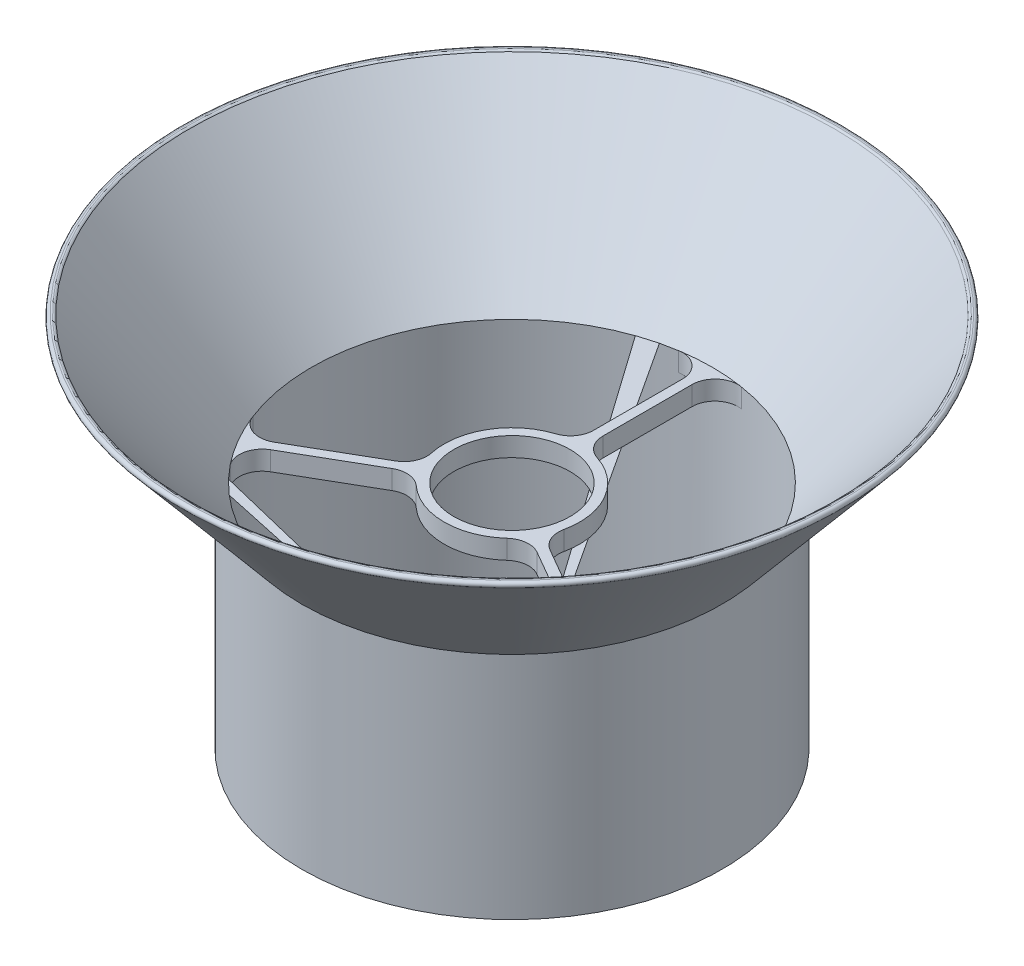
from build123d import *

# Parameters (mm, degrees)
SKETCH1_R           = 69.723
SKETCH1_R_2         = 66.548
BOSS_EXTRUDE1_DEPTH = 76.2
SKETCH2_R           = 22.479
SKETCH2_R_2         = 19.304
BOSS_EXTRUDE2_DEPTH = 6.35
BOSS_EXTRUDE3_START = -6.35
BOSS_EXTRUDE3_DEPTH = 6.35
CIRPATTERN1_COUNT   = 3
FILLET4_R           = 7.62
FILLET6_R           = 1.016


with BuildPart() as part:
    # Sketch1 → Boss-Extrude1 (new body)
    with BuildSketch(Plane(origin=(0, 0, 0), x_dir=(1, 0, 0), z_dir=(0, 1, 0))):
        with Locations(Location((0, 0, 0), (0, 0, 90))):
            Circle(SKETCH1_R)
        with Locations(Location((0, 0, 0), (0, 0, 90))):
            Circle(SKETCH1_R_2, mode=Mode.SUBTRACT)
    extrude(amount=BOSS_EXTRUDE1_DEPTH)



with BuildPart() as body_2:
    # Sketch2 → Boss-Extrude2 (new body)
    with BuildSketch(Plane(origin=(0, 76.2, 0), x_dir=(1, 0, 0), z_dir=(0, 1, 0))):
        with Locations(Location((0, 0, 0), (0, 0, 270))):
            Circle(SKETCH2_R)
        with Locations(Location((0, 0, 0), (0, 0, 270))):
            Circle(SKETCH2_R_2, mode=Mode.SUBTRACT)
    extrude(amount=-BOSS_EXTRUDE2_DEPTH)


with BuildPart() as part_1:
    add(part.part)

    add(body_2.part)  # Boss-Extrude3 merges body 2
    # Sketch3 → Boss-Extrude3 (add)
    with BuildSketch(Plane(origin=(0, 76.2, 0), x_dir=(1, 0, 0), z_dir=(0, 1, 0)).offset(BOSS_EXTRUDE3_START)):
        with BuildLine():
            Line((-1.5875, 22.422874141), (-1.5875, 66.52906243))
            ThreePointArc((-1.5875, 66.52906243), (0, 66.548), (1.5875, 66.52906243))
            Line((1.5875, 66.52906243), (1.5875, 22.422874141))
            ThreePointArc((1.5875, 22.422874141), (0, 22.479), (-1.5875, 22.422874141))
        make_face()
    boss_extrude3 = extrude(amount=BOSS_EXTRUDE3_DEPTH)

    # CirPattern1: Boss-Extrude3 ×3 about axis
    cirpattern1_axis = Axis((0, 0, 0), (0, 1, 0))
    for i in range(1, CIRPATTERN1_COUNT):
        add(boss_extrude3.rotate(cirpattern1_axis, i * 360 / CIRPATTERN1_COUNT))

    # Sketch5 → Revolve2 (revolve)
    with BuildSketch(Plane.XY, mode=Mode.PRIVATE) as revolve2_sk:
        Polygon((66.52906243, 76.2), (107.346075645, 124.843822138), (110.540013215, 124.843822138), (69.723, 76.2), align=None)
    revolve(revolve2_sk.sketch.rotate(Axis((0, 76.2, 0), (0, -1, 0)), 90), axis=Axis((0, 76.2, 0), (0, -1, 0)))

    # Fillet4
    # the kernel refuses this fillet: 7.62 mm, written as the material it adds along each edge
    with BuildSketch(Plane(origin=(1.5875, 69.85, -22.422874141), x_dir=(0.9818555419021507, 0, 0.18963041643163103), z_dir=(0, 1, 0)), Plane(origin=(-20.212528632, 69.85, 9.836621742), x_dir=(-0.3267030129910606, 0, -0.9451270503496146), z_dir=(0, 1, 0)), Plane(origin=(18.625028632, 69.85, 12.586252399), x_dir=(-0.6551525289110903, 0, 0.7554966339179832), z_dir=(0, 1, 0))) as fillet4_piece_1:
        with BuildLine():
            CenterArc((6.299731081, 7.565105602), FILLET4_R, 190.931216516, 72.187250076)
            Line((-1.182008148, 6.120121829), (0, 0))
            ThreePointArc((0, 0), (2.693363288, 0.161938473), (5.386726576, 0))
        make_face()
    extrude(amount=6.35)
    with BuildSketch(Plane(origin=(-1.5875, 69.85, -22.422874141), x_dir=(0, 0, -1), z_dir=(0, 1, 0)), Plane(origin=(-18.625028632, 69.85, 12.586252399), x_dir=(-0.8660254037844387, 0, 0.49999999999999983), z_dir=(0, 1, 0))) as fillet4_piece_2:
        with BuildLine():
            CenterArc((6.233220232, 7.62), FILLET4_R, 197.812749924, 72.187250076)
            ThreePointArc((-1.021487204, 5.288987342), (-0.351743415, 2.675202131), (0, 0))
            Line((0, 0), (6.233220232, 0))
        make_face()
    extrude(amount=6.35)
    with BuildSketch(Plane(origin=(-1.5875, 69.85, -66.52906243), x_dir=(-0.9959189542007358, 0, 0.09025207290534944), z_dir=(0, 1, 0)), Plane(origin=(-56.822108154, 69.85, 34.639346543), x_dir=(0.5761200649806046, 0, 0.8173650779955944), z_dir=(0, 1, 0))) as fillet4_piece_3:
        with BuildLine():
            CenterArc((8.340236793, 7.60314841), FILLET4_R, 174.821891179, 98.989299345)
            Line((0.751334362, 8.290869205), (0, 0))
            ThreePointArc((0, 0), (4.423364453, -0.147170556), (8.846728906, 0))
        make_face()
    extrude(amount=6.35)
    with BuildSketch(Plane(origin=(1.5875, 69.85, -66.52906243), x_dir=(0, 0, 1), z_dir=(0, 1, 0))) as fillet4_piece_4:
        with BuildLine():
            CenterArc((8.324843272, 7.62), FILLET4_R, 171.010700655, 98.989299345)
            ThreePointArc((0.798435622, 8.810625), (0.252647865, 4.418594948), (0, 0))
            Line((0, 0), (8.324843272, 0))
        make_face()
    extrude(amount=6.35)
    with BuildSketch(Plane(origin=(-58.409608154, 69.85, 31.889715886), x_dir=(-0.41979888922013026, 0, -0.9076171509009427), z_dir=(0, 1, 0)), Plane(origin=(56.822108154, 69.85, 34.639346543), x_dir=(-0.5761200649806054, 0, 0.8173650779955935), z_dir=(0, 1, 0))) as fillet4_piece_5:
        with BuildLine():
            CenterArc((8.340236793, -7.60314841), FILLET4_R, 86.188809476, 98.989299345)
            Line((0.751334362, -8.290869205), (0, 0))
            ThreePointArc((0, 0), (4.423364453, 0.147170556), (8.846728906, 0))
        make_face()
    extrude(amount=6.35)
    with BuildSketch(Plane(origin=(20.212528632, 69.85, 9.836621742), x_dir=(0.32670301299106214, 0, -0.9451270503496141), z_dir=(0, 1, 0))) as fillet4_piece_6:
        with BuildLine():
            CenterArc((6.299731081, -7.565105602), FILLET4_R, 96.881533408, 72.187250076)
            Line((-1.182008148, -6.120121829), (0, 0))
            ThreePointArc((0, 0), (2.693363288, -0.161938473), (5.386726576, 0))
        make_face()
    extrude(amount=6.35)
    with BuildSketch(Plane(origin=(58.409608154, 69.85, 31.889715886), x_dir=(-0.8660254037844388, 0, -0.49999999999999967), z_dir=(0, 1, 0))) as fillet4_piece_7:
        with BuildLine():
            CenterArc((8.324843272, -7.62), FILLET4_R, 90, 98.989299345)
            ThreePointArc((0.798435622, -8.810625), (0.252647865, -4.418594948), (0, 0))
            Line((0, 0), (8.324843272, 0))
        make_face()
    extrude(amount=6.35)

    # Fillet6
    fillet6_edges = [part_1.edges().sort_by_distance(p)[0] for p in [
        (0, 124.843822138, -110.540013215),
        (0, 124.843822138, -107.346075645),
    ]]
    fillet(fillet6_edges, radius=FILLET6_R)


solid = part_1.part
